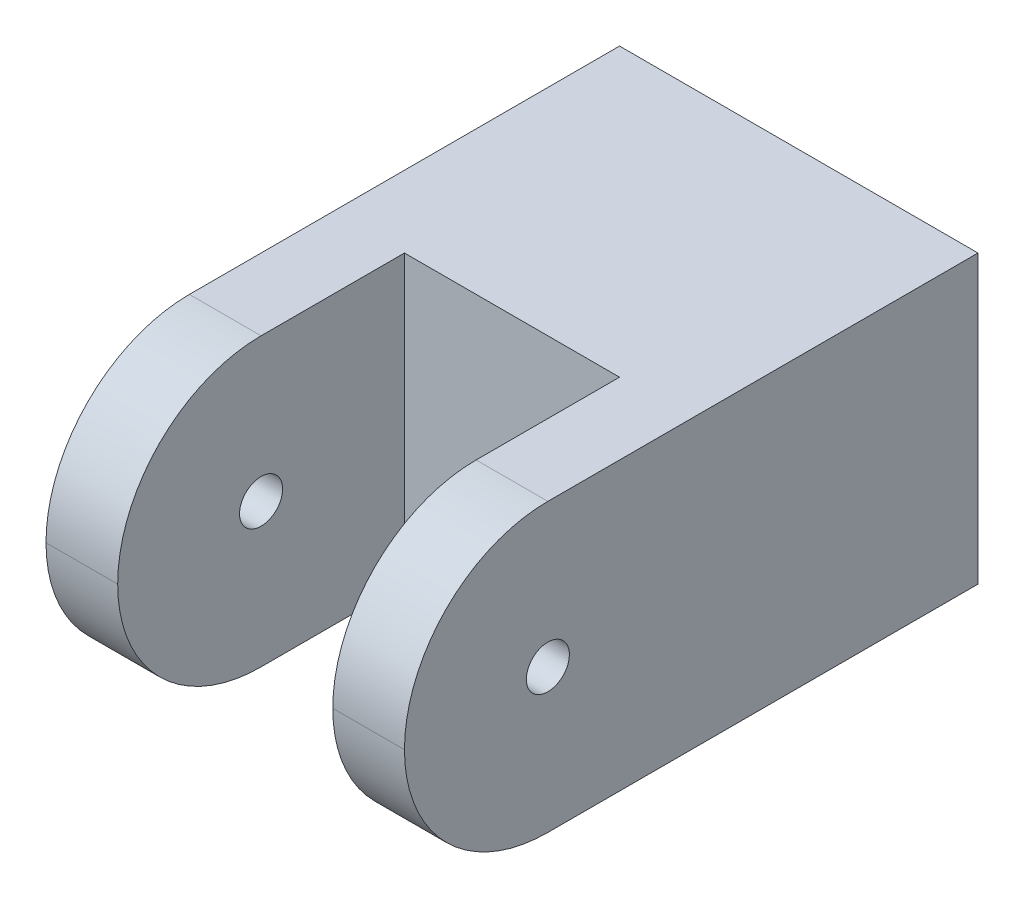
from build123d import *

# Parameters (mm, degrees)
SKETCH1_W           = 25
SKETCH1_H           = 20
BOSS_EXTRUDE1_DEPTH = 40
SKETCH2_W           = 15
SKETCH2_H           = 20
CUT_EXTRUDE1_DEPTH  = 20
SKETCH3_R           = 1.5
CUT_EXTRUDE2_DEPTH  = 30
FILLET1_R           = 10
SKETCH4_R           = 1.5
CUT_EXTRUDE3_DEPTH  = 20
FILLET2_R           = 1
CUT_EXTRUDE4_DEPTH  = 20


with BuildPart() as part:
    # Sketch1 → Boss-Extrude1 (new body)
    with BuildSketch(Plane.XY):
        Rectangle(SKETCH1_W, SKETCH1_H)
    extrude(amount=BOSS_EXTRUDE1_DEPTH)

    # Sketch2 → Cut-Extrude1 (cut)
    with BuildSketch(Plane.XY.offset(40)):
        Rectangle(SKETCH2_W, SKETCH2_H)
    extrude(amount=-CUT_EXTRUDE1_DEPTH, mode=Mode.SUBTRACT)

    # Sketch3 → Cut-Extrude2 (cut)
    with BuildSketch(Plane(origin=(12.5, 0, 0), x_dir=(0, 0, -1), z_dir=(1, 0, 0))):
        with Locations(Location((-30, 0, 0), (0, 0, 90))):
            Circle(SKETCH3_R)
    extrude(amount=-CUT_EXTRUDE2_DEPTH, mode=Mode.SUBTRACT)

    # Fillet1
    fillet1_edges = [part.edges().sort_by_distance(p)[0] for p in [
        (-10, 10, 40),
        (10, 10, 40),
        (10, -10, 40),
        (-10, -10, 40),
    ]]
    fillet(fillet1_edges, radius=FILLET1_R - 0.0001)  # a hair under: the kernel refuses the full size

    # Sketch4 → Cut-Extrude3 (cut)
    with BuildSketch(Plane.XY.offset(20)):
        with Locations((0, -7)):
            Circle(SKETCH4_R)
    extrude(amount=-CUT_EXTRUDE3_DEPTH, mode=Mode.SUBTRACT)

    # Fillet2
    fillet2_edges = [part.edges().sort_by_distance(p)[0] for p in [
        (-1.5, -7, 20),
    ]]
    fillet(fillet2_edges, radius=FILLET2_R)

    # Sketch5 → Cut-Extrude4 (cut)
    with BuildSketch(Plane.XY.offset(20)):
        with BuildLine():
            Line((-3, -2), (3, -2))
            ThreePointArc((3, -2), (4, -3), (3, -4))
            Line((3, -4), (-3, -4))
            ThreePointArc((-3, -4), (-4, -3), (-3, -2))
        make_face()
    extrude(amount=-CUT_EXTRUDE4_DEPTH, mode=Mode.SUBTRACT)


solid = part.part
